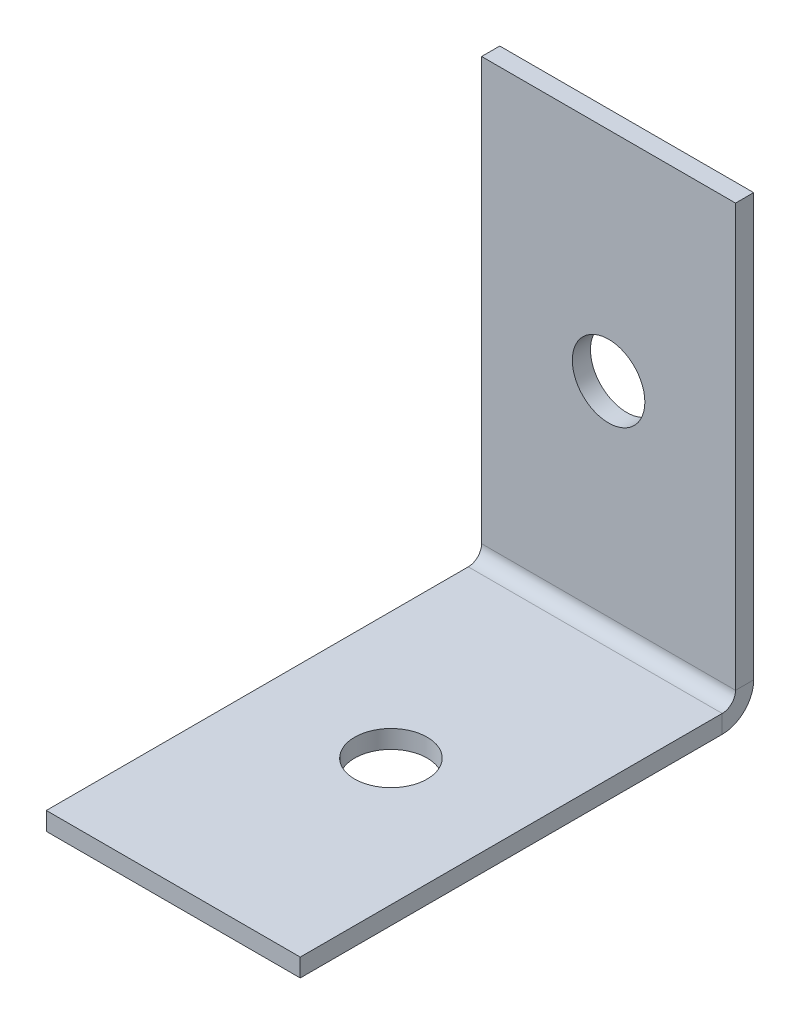
from build123d import *

# Parameters (mm, degrees)
BRIDA_BASE1_DEPTH     = 7
CORTAR_EXTRUIR1_REACH = 37.355
CROQUIS6_R            = 2
CORTAR_EXTRUIR2_REACH = 37.355
CROQUIS9_R            = 2


# Sheet-metal steps are written as plain solids
with BuildPart() as part:
    # Croquis1 → Brida base1 (new, symmetric)
    with BuildSketch(Plane(origin=(0, 0, 0), x_dir=(0, 0, -1), z_dir=(1, 0, 0))):
        with BuildLine():
            Line((0, 25), (0, 1.7366))
            ThreePointArc((0, 1.7366), (-0.508638364, 0.508638364), (-1.7366, 0))
            Line((-1.7366, 0), (-25, 0))
            Line((-25, 0), (-25, 1))
            Line((-25, 1), (-1.7366, 1))
            ThreePointArc((-1.7366, 1), (-1.215745145, 1.215745145), (-1, 1.7366))
            Line((-1, 1.7366), (-1, 25))
            Line((-1, 25), (0, 25))
        make_face()
    extrude(amount=BRIDA_BASE1_DEPTH, both=True)

    # Croquis6 → Cortar-Extruir1 (cut, up to next)
    with BuildSketch(Plane.XY.offset(1), mode=Mode.PRIVATE) as cortar_extruir1_sk1:
        with Locations((0, 13)):
            Circle(CROQUIS6_R)
    cortar_extruir1_tool1 = extrude(cortar_extruir1_sk1.sketch, amount=-CORTAR_EXTRUIR1_REACH, mode=Mode.PRIVATE) & part.part
    add(cortar_extruir1_tool1.solids().sort_by_distance((0, 13, 1))[0], mode=Mode.SUBTRACT)

    # Croquis9 → Cortar-Extruir2 (cut, up to next)
    with BuildSketch(Plane(origin=(0, 1, 0), x_dir=(1, 0, 0), z_dir=(0, 1, 0)), mode=Mode.PRIVATE) as cortar_extruir2_sk1:
        with Locations(Location((0, -13, 0), (0, 0, 270))):
            Circle(CROQUIS9_R)
    cortar_extruir2_tool1 = extrude(cortar_extruir2_sk1.sketch, amount=-CORTAR_EXTRUIR2_REACH, mode=Mode.PRIVATE) & part.part
    add(cortar_extruir2_tool1.solids().sort_by_distance((0, 1, 13))[0], mode=Mode.SUBTRACT)


solid = part.part
